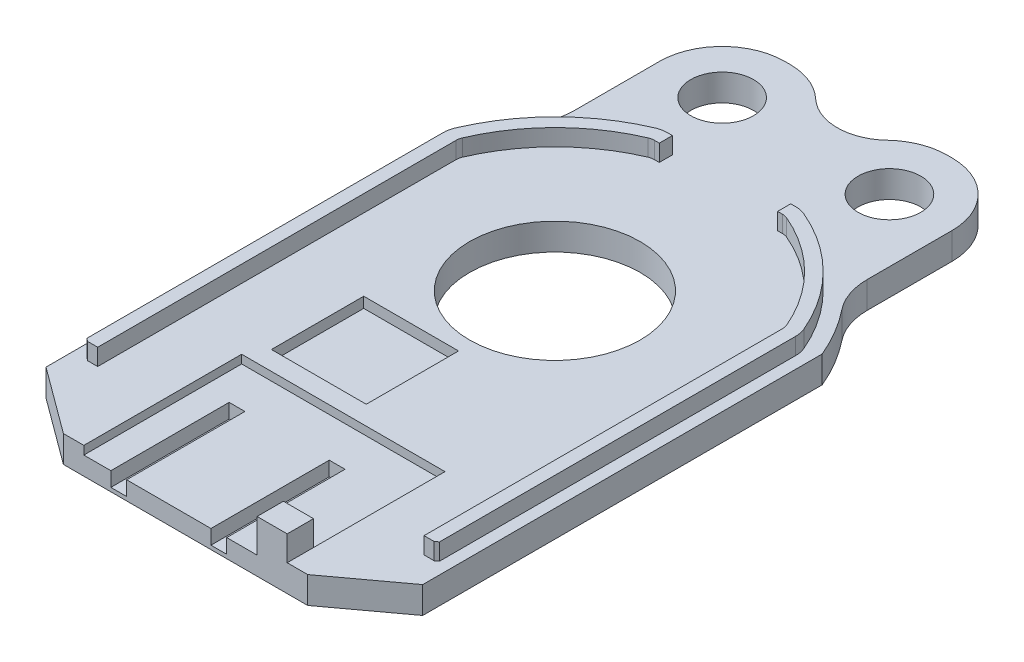
from build123d import *

# Parameters (mm, degrees)
SKETCH1_R           = 6.477
BOSS_EXTRUDE1_DEPTH = 2.032
CUT_EXTRUDE1_DEPTH  = 0.64008
SKETCH3_W           = 1.19888
SKETCH3_H           = 8.98144
CUT_EXTRUDE2_DEPTH  = 1.09982
SKETCH4_W           = 7.19836
SKETCH4_H           = 7.00786
CUT_EXTRUDE3_DEPTH  = 0.8001
BOSS_EXTRUDE2_DEPTH = 1.27
SKETCH6_W           = 2.286
SKETCH6_H           = 1.99898
BOSS_EXTRUDE3_DEPTH = 2.54
SKETCH7_R           = 2.38125
BOSS_EXTRUDE4_DEPTH = 2.032


with BuildPart() as part:
    # Sketch1 → Boss-Extrude1 (new body)
    with BuildSketch(Plane(origin=(0, 0, 0), x_dir=(1, 0, 0), z_dir=(0, 1, 0))):
        with BuildLine():
            Line((-14.3002, 5.9944), (-14.3002, -24.3332))
            Line((-14.3002, -24.3332), (-9.271, -28.0416))
            Line((-9.271, -28.0416), (9.271, -28.0416))
            Line((9.271, -28.0416), (14.3002, -24.3332))
            Line((14.3002, -24.3332), (14.3002, 5.9944))
            ThreePointArc((14.3002, 5.9944), (0, 15.505758653), (-14.3002, 5.9944))
        make_face()
        Circle(SKETCH1_R, mode=Mode.SUBTRACT)
    extrude(amount=BOSS_EXTRUDE1_DEPTH)

    # Sketch2 → Cut-Extrude1 (cut)
    with BuildSketch(Plane(origin=(0, 2.032, 0), x_dir=(1, 0, 0), z_dir=(0, 1, 0))):
        Polygon((0, -28.0416), (-7.71906, -28.0416), (-7.71906, -16.06042), (7.71906, -16.06042), (7.71906, -28.0416), align=None)
    extrude(amount=-CUT_EXTRUDE1_DEPTH, mode=Mode.SUBTRACT)

    # Sketch3 → Cut-Extrude2 (cut)
    with BuildSketch(Plane(origin=(0, 1.39192, 0), x_dir=(1, 0, 0), z_dir=(0, 1, 0))):
        with Locations((-5.06984, -23.55088)):
            Rectangle(SKETCH3_W, SKETCH3_H)
        with Locations((2.52984, -23.55088)):
            Rectangle(SKETCH3_W, SKETCH3_H)
    extrude(amount=-CUT_EXTRUDE2_DEPTH, mode=Mode.SUBTRACT)

    # Sketch4 → Cut-Extrude3 (cut)
    with BuildSketch(Plane(origin=(0, 2.032, 0), x_dir=(1, 0, 0), z_dir=(0, 1, 0))):
        with Locations((-3.299968, -11.116564)):
            Rectangle(SKETCH4_W, SKETCH4_H)
    extrude(amount=-CUT_EXTRUDE3_DEPTH, mode=Mode.SUBTRACT)

    # Sketch5 → Boss-Extrude2 (add)
    with BuildSketch(Plane(origin=(0, 2.032, 0), x_dir=(1, 0, 0), z_dir=(0, 1, 0))):
        with BuildLine():
            Line((12.40282, -22.33422), (13.171678, -22.33422))
            Line((13.171678, -22.33422), (13.40104, -22.152864))
            Line((13.40104, -22.152864), (13.40104, 4.882896))
            ThreePointArc((13.40104, 4.882896), (13.360125716, 5.283490726), (13.23975, 5.667756))
            ThreePointArc((13.23975, 5.667756), (10.160746855, 10.20631074), (5.608066, 13.264388))
            ThreePointArc((5.608066, 13.264388), (5.250053957, 13.366581837), (4.87934, 13.40104))
            Line((4.87934, 13.40104), (4.50342, 13.40104))
            Line((4.50342, 13.40104), (4.50342, 12.40282))
            Line((4.50342, 12.40282), (4.87934, 12.40282))
            ThreePointArc((4.87934, 12.40282), (5.080028543, 12.382451063), (5.272532, 12.322175))
            ThreePointArc((5.272532, 12.322175), (9.477779109, 9.479294357), (12.322175, 5.275072))
            ThreePointArc((12.322175, 5.275072), (12.382451063, 5.082568543), (12.40282, 4.88188))
            Line((12.40282, 4.88188), (12.40282, -22.33422))
        make_face()
        with BuildLine():
            Line((-4.850750436, 13.40104), (-4.474830436, 13.40104))
            Line((-4.474830436, 13.40104), (-4.474830436, 12.40282))
            Line((-4.474830436, 12.40282), (-4.850750436, 12.40282))
            ThreePointArc((-4.850750436, 12.40282), (-5.051438979, 12.382451063), (-5.243942436, 12.322175))
            ThreePointArc((-5.243942436, 12.322175), (-9.449189546, 9.479294357), (-12.293585436, 5.275072))
            ThreePointArc((-12.293585436, 5.275072), (-12.353861499, 5.082568543), (-12.374230436, 4.88188))
            Line((-12.374230436, 4.88188), (-12.374230436, -22.33422))
            Line((-12.374230436, -22.33422), (-13.143088436, -22.33422))
            Line((-13.143088436, -22.33422), (-13.372450436, -22.152864))
            Line((-13.372450436, -22.152864), (-13.372450436, 4.882896))
            ThreePointArc((-13.372450436, 4.882896), (-13.331536152, 5.283490726), (-13.211160436, 5.667756))
            ThreePointArc((-13.211160436, 5.667756), (-10.132157291, 10.20631074), (-5.579476436, 13.264388))
            ThreePointArc((-5.579476436, 13.264388), (-5.221464393, 13.366581837), (-4.850750436, 13.40104))
        make_face()
    extrude(amount=BOSS_EXTRUDE2_DEPTH)

    # Sketch6 → Boss-Extrude3 (add)
    with BuildSketch(Plane(origin=(0, 1.39192, 0), x_dir=(1, 0, 0), z_dir=(0, 1, 0))):
        with Locations((6.57606, -27.04211)):
            Rectangle(SKETCH6_W, SKETCH6_H)
    extrude(amount=BOSS_EXTRUDE3_DEPTH)

    # Sketch7 → Boss-Extrude4 (add)
    with BuildSketch(Plane.XZ):
        with BuildLine():
            ThreePointArc((-12.144798566, -9.640146223), (-11.377973728, -11.033206497), (-11.1125, -12.601058837))
            Line((-11.1125, -12.601058837), (-11.1125, -19.05))
            ThreePointArc((-11.1125, -19.05), (-9.717596045, -22.417596045), (-6.35, -23.8125))
            Line((-6.35, -23.8125), (-5.983425441, -23.8125))
            ThreePointArc((-5.983425441, -23.8125), (-4.22646321, -23.476566386), (-2.717363519, -22.516157205))
            ThreePointArc((-2.717363519, -22.516157205), (0, -21.4376), (2.717363519, -22.516157205))
            ThreePointArc((2.717363519, -22.516157205), (4.22646321, -23.476566386), (5.983425441, -23.8125))
            Line((5.983425441, -23.8125), (6.35, -23.8125))
            ThreePointArc((6.35, -23.8125), (9.717596045, -22.417596045), (11.1125, -19.05))
            Line((11.1125, -19.05), (11.1125, -12.601058837))
            ThreePointArc((11.1125, -12.601058837), (11.377973728, -11.033206497), (12.144798566, -9.640146223))
            ThreePointArc((12.144798566, -9.640146223), (0, -15.505758653), (-12.144798566, -9.640146223))
        make_face()
        with Locations((-6.35, -19.05)):
            Circle(SKETCH7_R, mode=Mode.SUBTRACT)
        with Locations((6.35, -19.05)):
            Circle(SKETCH7_R, mode=Mode.SUBTRACT)
    extrude(amount=-BOSS_EXTRUDE4_DEPTH)


solid = part.part
